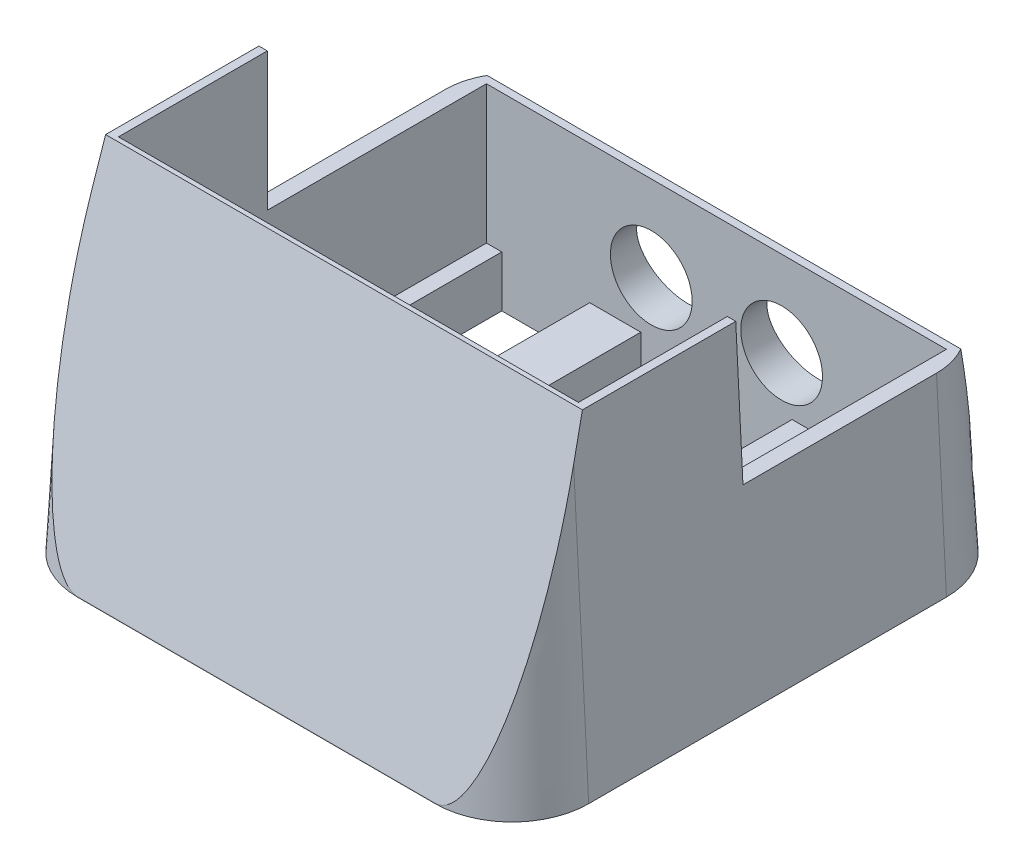
from build123d import *

# Parameters (mm, degrees)
BOSS_EXTRUDE1_DEPTH     = 10
SKETCH2_W               = 17.2
SKETCH2_H               = 43
CUT_EXTRUDE1_DEPTH      = 72.414284285
SKETCH3_W               = 90
SKETCH3_H               = 34
SKETCH3_W_2             = 80
SKETCH3_H_2             = 24
BOSS_EXTRUDE3_DEPTH     = 15
SKETCH4_W               = 49.6
SKETCH4_H               = 5
BOSS_EXTRUDE4_DEPTH     = 10
SKETCH5_W               = 15
SKETCH5_H               = 22
BOSS_EXTRUDE5_DEPTH     = 5
SKETCH6_W               = 90
SKETCH6_H               = 77
BOSS_EXTRUDE6_DEPTH     = 15
BOSS_EXTRUDE8_DEPTH     = 39
CHAMFER1_SIZE           = 64
CHAMFER1_SIZE_2         = 3.354097874
CHAMFER2_SIZE           = 64
CHAMFER2_SIZE_2         = 11.405813635
CHAMFER3_SIZE           = 64
CHAMFER3_SIZE_2         = 13.775745352
CUT_EXTRUDE3_DEPTH      = 95.500525601
CUT_EXTRUDE3_DEPTH_BACK = 95.500525601
SKETCH10_W              = 50
SKETCH10_H              = 27
SKETCH15_R              = 8
CUT_EXTRUDE5_DEPTH      = 122.227059686
CUT_EXTRUDE6_DEPTH      = 2.5
SKETCH18_W              = 29.6
SKETCH18_H              = 43
CUT_EXTRUDE7_DEPTH      = 10
CUT_EXTRUDE8_DEPTH      = 15
SKETCH21_W              = 29.6
SKETCH21_H              = 33
BOSS_EXTRUDE10_DEPTH    = 2.5
SKETCH23_W              = 2.05
SKETCH23_H              = 13
BOSS_EXTRUDE11_DEPTH    = 15
SKETCH24_W              = 90
SKETCH24_H              = 72
CUT_EXTRUDE9_DEPTH      = 54


with BuildPart() as part:
    # Sketch1 → Boss-Extrude1 (new body)
    with BuildSketch(Plane(origin=(0, 0, 0), x_dir=(1, 0, 0), z_dir=(0, 1, 0))):
        with BuildLine():
            Line((-35, 50), (35, 50))
            ThreePointArc((35, 50), (45.606601718, 45.606601718), (50, 35))
            Line((50, 35), (50, -35))
            ThreePointArc((50, -35), (45.606601718, -45.606601718), (35, -50))
            Line((35, -50), (-35, -50))
            ThreePointArc((-35, -50), (-45.606601718, -45.606601718), (-50, -35))
            Line((-50, -35), (-50, 35))
            ThreePointArc((-50, 35), (-45.606601718, 45.606601718), (-35, 50))
        make_face()
    extrude(amount=BOSS_EXTRUDE1_DEPTH)

    # Sketch2 → Cut-Extrude1 (cut, through all)
    with BuildSketch(Plane(origin=(0, 10, 0), x_dir=(1, 0, 0), z_dir=(0, 1, 0))):
        with Locations((-33.4, 18.5)):
            Rectangle(SKETCH2_W, SKETCH2_H)
        with Locations((33.4, 18.5)):
            Rectangle(SKETCH2_W, SKETCH2_H)
    extrude(amount=-CUT_EXTRUDE1_DEPTH, mode=Mode.SUBTRACT)

    # Sketch3 → Boss-Extrude3 (add)
    with BuildSketch(Plane(origin=(0, 10, 0), x_dir=(1, 0, 0), z_dir=(0, 1, 0))):
        with Locations((0, -20)):
            Rectangle(SKETCH3_W, SKETCH3_H)
        with Locations((0, -20)):
            Rectangle(SKETCH3_W_2, SKETCH3_H_2, mode=Mode.SUBTRACT)
    extrude(amount=BOSS_EXTRUDE3_DEPTH)

    # Sketch4 → Boss-Extrude4 (add)
    with BuildSketch(Plane(origin=(0, 10, 0), x_dir=(1, 0, 0), z_dir=(0, 1, 0))):
        with Locations((0, 10)):
            Rectangle(SKETCH4_W, SKETCH4_H)
        with Locations((0, 27)):
            Rectangle(SKETCH4_W, SKETCH4_H)
    extrude(amount=BOSS_EXTRUDE4_DEPTH)

    # Sketch5 → Boss-Extrude5 (add)
    with BuildSketch(Plane(origin=(0, 20, 0), x_dir=(1, 0, 0), z_dir=(0, 1, 0))):
        with Locations((-17.3, 18.5)):
            Rectangle(SKETCH5_W, SKETCH5_H)
        with Locations((17.3, 18.5)):
            Rectangle(SKETCH5_W, SKETCH5_H)
    extrude(amount=BOSS_EXTRUDE5_DEPTH)

    # Sketch6 → Boss-Extrude6 (add)
    with BuildSketch(Plane(origin=(0, 10, 0), x_dir=(1, 0, 0), z_dir=(0, 1, 0))):
        with BuildLine():
            Line((-50, 35), (-50, -35))
            ThreePointArc((-50, -35), (-45.606601718, -45.606601718), (-35, -50))
            Line((-35, -50), (35, -50))
            ThreePointArc((35, -50), (45.606601718, -45.606601718), (50, -35))
            Line((50, -35), (50, 35))
            ThreePointArc((50, 35), (45.606601718, 45.606601718), (35, 50))
            Line((35, 50), (-35, 50))
            ThreePointArc((-35, 50), (-45.606601718, 45.606601718), (-50, 35))
        make_face()
        with Locations((0, 1.5)):
            Rectangle(SKETCH6_W, SKETCH6_H, mode=Mode.SUBTRACT)
    extrude(amount=BOSS_EXTRUDE6_DEPTH)

    # Sketch9 → Boss-Extrude8 (add)
    with BuildSketch(Plane(origin=(0, 25, 0), x_dir=(1, 0, 0), z_dir=(0, 1, 0))):
        with BuildLine():
            Line((-50, 35), (-50, -35))
            ThreePointArc((-50, -35), (-45.606601718, -45.606601718), (-35, -50))
            Line((-35, -50), (35, -50))
            ThreePointArc((35, -50), (45.606601718, -45.606601718), (50, -35))
            Line((50, -35), (50, 35))
            ThreePointArc((50, 35), (45.606601718, 45.606601718), (35, 50))
            Line((35, 50), (-35, 50))
            ThreePointArc((-35, 50), (-45.606601718, 45.606601718), (-50, 35))
        make_face()
        with BuildLine():
            Line((-45, 35), (-45, -32))
            Line((-45, -32), (45, -32))
            Line((45, -32), (45, 35))
            ThreePointArc((45, 35), (44.659258263, 37.588190451), (43.660254038, 40))
            Line((43.660254038, 40), (-43.660254038, 40))
            ThreePointArc((-43.660254038, 40), (-44.659258263, 37.588190451), (-45, 35))
        make_face(mode=Mode.SUBTRACT)
    extrude(amount=BOSS_EXTRUDE8_DEPTH)

    # Chamfer1
    # the kernel refuses this chamfer: 64, 3.354097874 mm, written as the material it takes off along each edge
    with BuildSketch(Plane(origin=(-35, 64, 50), x_dir=(0, -0.9999979738662979, 0.002013023422382214), z_dir=(1, 0, 0)), Plane(origin=(50, 64, 35), x_dir=(0.002013023422382214, -0.9999979738662979, 0), z_dir=(0, 0, -1)), Plane(origin=(-50, 64, -35), x_dir=(-0.002013023422382214, -0.9999979738662979, 0), z_dir=(0, 0, 1)), Plane(origin=(35, 64, -50), x_dir=(0, -0.9999979738662979, -0.002013023422382214), z_dir=(-1, 0, 0))) as chamfer1_piece_1:
        Polygon((CHAMFER1_SIZE * 0.999997973866, CHAMFER1_SIZE * 0.00201302342238), (-CHAMFER1_SIZE_2 * 0.00201302342245, CHAMFER1_SIZE_2 * 0.9999979739), (0, 0), align=None)
    extrude(amount=70, mode=Mode.SUBTRACT)
    with BuildSketch(Plane(origin=(35, 64, 35), x_dir=(0, 0, 1), z_dir=(-1, 0, 0))) as chamfer1_piece_2:
        Polygon((15, -CHAMFER1_SIZE), (15 - CHAMFER1_SIZE_2, 0), (15, 0), align=None)
    revolve(axis=Axis((35, 64, 35), (0, 1, 0)), revolution_arc=90, mode=Mode.SUBTRACT)
    with BuildSketch(Plane(origin=(-35, 64, 35), x_dir=(-1, 0, 0), z_dir=(0, 0, -1))) as chamfer1_piece_3:
        Polygon((15, -CHAMFER1_SIZE), (15 - CHAMFER1_SIZE_2, 0), (15, 0), align=None)
    revolve(axis=Axis((-35, 64, 35), (0, 1, 0)), revolution_arc=90, mode=Mode.SUBTRACT)
    with BuildSketch(Plane(origin=(35, 64, -35), x_dir=(1, 0, 0), z_dir=(0, 0, 1))) as chamfer1_piece_4:
        Polygon((15, -CHAMFER1_SIZE), (15 - CHAMFER1_SIZE_2, 0), (15, 0), align=None)
    revolve(axis=Axis((35, 64, -35), (0, 1, 0)), revolution_arc=90, mode=Mode.SUBTRACT)
    with BuildSketch(Plane(origin=(-35, 64, -35), x_dir=(0, 0, -1), z_dir=(1, 0, 0))) as chamfer1_piece_5:
        Polygon((15 - CHAMFER1_SIZE_2, 0), (15, -CHAMFER1_SIZE), (15, 0), align=None)
    revolve(axis=Axis((-35, 64, -35), (0, 1, 0)), revolution_arc=90, mode=Mode.SUBTRACT)

    # Chamfer2
    # the kernel refuses this chamfer: 64, 11.405813635 mm, written as the material it takes off along each edge
    with BuildSketch(Plane(origin=(201.306482971, 64, -46.645902126), x_dir=(0, -0.9982575003065525, -0.05900816114499234), z_dir=(-1, 0, 0))) as chamfer2_piece_1:
        Polygon((CHAMFER2_SIZE * 0.999977671636, CHAMFER2_SIZE * 0.0066825316561), (-CHAMFER2_SIZE_2 * 0.0590081611462, CHAMFER2_SIZE_2 * 0.998257500326), (0, 0), align=None)
    extrude(amount=402.612965942, mode=Mode.SUBTRACT)

    # Chamfer3
    # the kernel refuses this chamfer: 64, 13.775745352 mm, written as the material it takes off along each edge
    with BuildSketch(Plane(origin=(-201.265469314, 64, 46.645902126), x_dir=(0, -0.9981787050157903, 0.06032638604292662), z_dir=(1, 0, 0))) as chamfer3_piece_1:
        Polygon((CHAMFER3_SIZE * 0.999967974892, CHAMFER3_SIZE * 0.00800307379952), (-CHAMFER3_SIZE_2 * 0.060326386045, CHAMFER3_SIZE_2 * 0.99817870505), (0, 0), align=None)
    extrude(amount=402.530938629, mode=Mode.SUBTRACT)

    # Sketch10 → Cut-Extrude3 (cut, two sides: drawn at the far end of the back side and taken through both)
    with BuildSketch(Plane(origin=(0, 1.307501734, 0), x_dir=(0, 0, 1), z_dir=(-1, 0, 0)).offset(-CUT_EXTRUDE3_DEPTH_BACK)):
        with Locations((-22.129843227, 49.192498266)):
            Rectangle(SKETCH10_W, SKETCH10_H)
    extrude(amount=CUT_EXTRUDE3_DEPTH + CUT_EXTRUDE3_DEPTH_BACK, mode=Mode.SUBTRACT)

    # Sketch15 → Cut-Extrude5 (cut, through all)
    with BuildSketch(Plane.XY.offset(-40)):
        with Locations((-12.75, 20.25)):
            Circle(SKETCH15_R)
        with Locations((12.75, 20.25)):
            Circle(SKETCH15_R)
    extrude(amount=-CUT_EXTRUDE5_DEPTH, mode=Mode.SUBTRACT)

    # Sketch17 → Cut-Extrude6 (cut)
    with BuildSketch(Plane(origin=(0, 0, -29.5), x_dir=(-1, 0, 0), z_dir=(0, 0, -1))):
        Polygon((-24.8, 10), (24.8, 10), (24.8, 25), (9.8, 25), (9.8, 20), (-9.8, 20), (-9.8, 25), (-24.8, 25), align=None)
    extrude(amount=-CUT_EXTRUDE6_DEPTH, mode=Mode.SUBTRACT)

    # Sketch18 → Cut-Extrude7 (cut)
    with BuildSketch(Plane.XZ):
        with Locations((0, -18.5)):
            Rectangle(SKETCH18_W, SKETCH18_H)
    extrude(amount=-CUT_EXTRUDE7_DEPTH, mode=Mode.SUBTRACT)

    # Sketch20 → Cut-Extrude8 (cut)
    with BuildSketch(Plane.XZ.offset(-25)):
        with BuildLine():
            Line((-45, -35), (-45, -40))
            Line((-45, -40), (-43.660254038, -40))
            ThreePointArc((-43.660254038, -40), (-44.659258263, -37.588190451), (-45, -35))
        make_face()
        with BuildLine():
            Line((45, -40), (45, -35))
            ThreePointArc((45, -35), (44.659258263, -37.588190451), (43.660254038, -40))
            Line((43.660254038, -40), (45, -40))
        make_face()
    extrude(amount=-CUT_EXTRUDE8_DEPTH, mode=Mode.SUBTRACT)

    # Sketch21 → Boss-Extrude10 (add)
    with BuildSketch(Plane.XZ):
        with Locations((0, -13.5)):
            Rectangle(SKETCH21_W, SKETCH21_H)
    extrude(amount=-BOSS_EXTRUDE10_DEPTH)

    # Sketch23 → Boss-Extrude11 (add)
    with BuildSketch(Plane(origin=(0, 10, 0), x_dir=(1, 0, 0), z_dir=(0, 1, 0))):
        with Locations((-23.775, 33.5)):
            Rectangle(SKETCH23_W, SKETCH23_H)
        with Locations((23.775, 33.5)):
            Rectangle(SKETCH23_W, SKETCH23_H)
    extrude(amount=BOSS_EXTRUDE11_DEPTH)

    # Sketch24 → Cut-Extrude9 (cut)
    with BuildSketch(Plane(origin=(0, 64, 0), x_dir=(1, 0, 0), z_dir=(0, 1, 0))):
        with Locations((0, 4)):
            Rectangle(SKETCH24_W, SKETCH24_H)
    extrude(amount=-CUT_EXTRUDE9_DEPTH, mode=Mode.SUBTRACT)


solid = part.part
